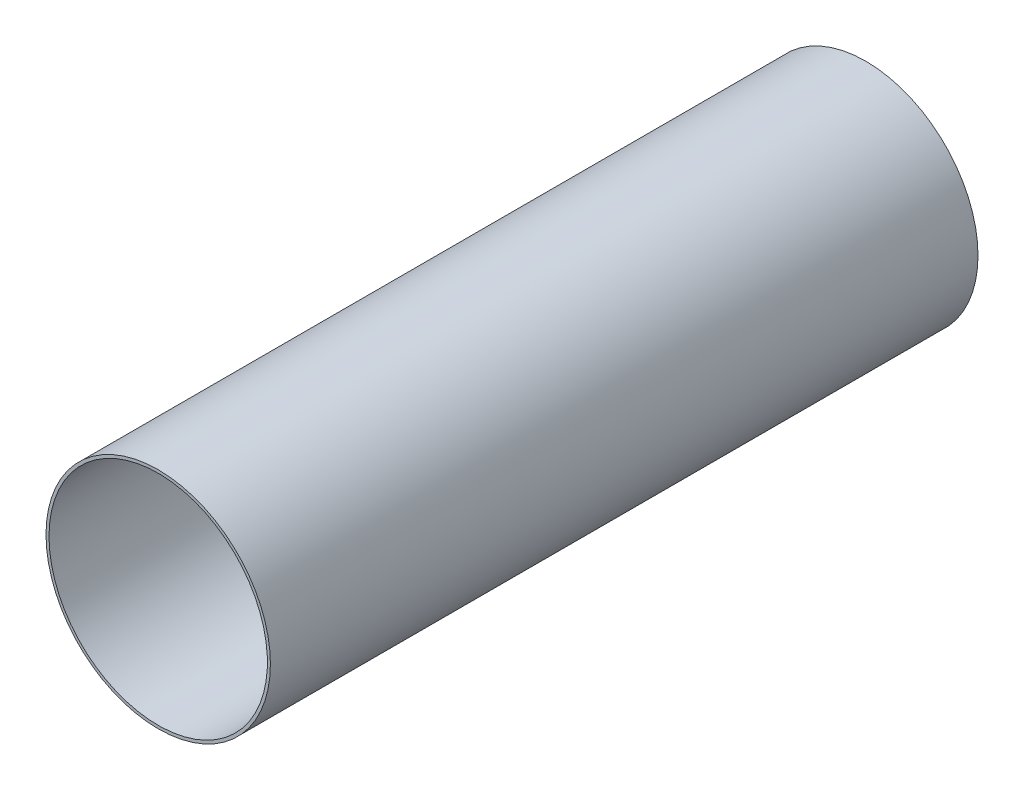
from build123d import *

# Parameters (mm, degrees)
SCHIZZO1_R                = 75
SCHIZZO1_R_2              = 73
ESTRUSIONE_SOTTILE1_DEPTH = 473


with BuildPart() as part:
    # Schizzo1 → Estrusione-Sottile1 (new body)
    with BuildSketch(Plane.XY):
        Circle(SCHIZZO1_R)
        Circle(SCHIZZO1_R_2, mode=Mode.SUBTRACT)
    extrude(amount=ESTRUSIONE_SOTTILE1_DEPTH)


solid = part.part
